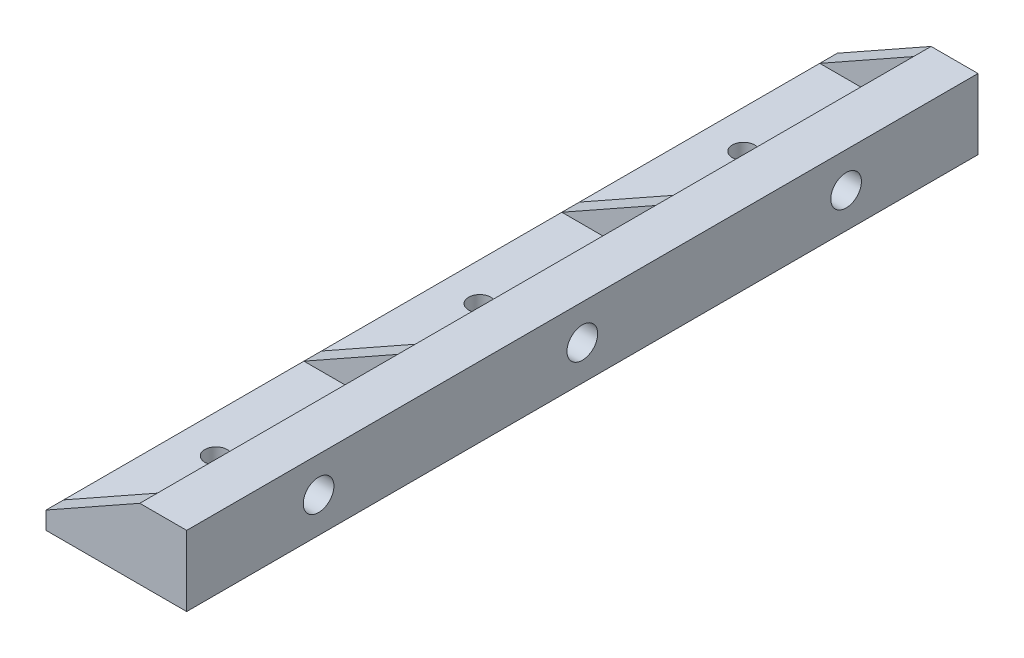
from build123d import *

# Parameters (mm, degrees)
BOSS_EXTRUDE1_DEPTH   = 135
RIB3_REACH            = 95.436
SKETCH4_WALL_W        = 207.229173432
SKETCH4_WALL_H        = 3
RIB4_START            = -3
RIB4_DEPTH            = 3
F_6_CLEARANCE_HOLE1_D = 3.7973
SKETCH6_R             = 2.3495
CUT_EXTRUDE1_DEPTH    = 7
SKETCH12_R            = 2.6162
CUT_EXTRUDE2_DEPTH    = 6.35


# Read off the part's stored shape, not the designer's step: Rib4
with BuildPart() as part:
    # Sketch1 → Boss-Extrude1 (new body)
    with BuildSketch(Plane.XY):
        with BuildLine():
            Line((0, 0), (0, 12))
            Line((0, 12), (-8, 12))
            Line((-8, 12), (-8, 6))
            ThreePointArc((-8, 6), (-8.878679656, 3.878679656), (-11, 3))
            Line((-11, 3), (-24, 3))
            Line((-24, 3), (-24, 0))
            Line((-24, 0), (0, 0))
        make_face()
    extrude(amount=BOSS_EXTRUDE1_DEPTH)

    # Sketch4 wall → Rib3 (add, up to next)
    with BuildSketch(Plane(origin=(-16, 7.5, 45.5), x_dir=(-0.871575537125, -0.490261239633, 0), z_dir=(-0.490261239633, 0.871575537125, 0)), mode=Mode.PRIVATE) as rib3_sk1:
        Rectangle(SKETCH4_WALL_W, SKETCH4_WALL_H)
    rib3_tool1 = extrude(rib3_sk1.sketch, amount=-RIB3_REACH, mode=Mode.PRIVATE) - part.part
    rib3 = rib3_tool1.solids().sort_by_distance((-16, 7.5, 45.5))[0]
    add(rib3)

    # Rib4 outline → Rib4 (add)
    with BuildSketch(Plane(origin=(0, 0, 0), x_dir=(-1, 0, 0), z_dir=(0, 0, -1)).offset(RIB4_START)):
        with BuildLine():
            Line((24, 3), (8, 12))
            Line((8, 12), (8, 6))
            ThreePointArc((8, 6), (8.878679656, 3.878679656), (11, 3))
            Line((11, 3), (24, 3))
        make_face()
    rib4 = extrude(amount=RIB4_DEPTH)

    # Mirror1: Rib3, Rib4 across plane
    add(rib3.mirror(Plane(origin=(0, 0, 67.5), x_dir=(1, 0, 0), z_dir=(0, 0, -1))))
    add(rib4.mirror(Plane(origin=(0, 0, 67.5), x_dir=(1, 0, 0), z_dir=(0, 0, -1))))

    # #6 Clearance Hole1 (through all)
    with Locations(Plane(origin=(0, 0, 0), x_dir=(-1, 0, 0), z_dir=(0, -1, 0))):
        with Locations((17.5, -22.5), (17.5, -112.5), (17.5, -67.5)):
            Hole(F_6_CLEARANCE_HOLE1_D / 2)

    # Sketch6 → Cut-Extrude1 (cut)
    with BuildSketch(Plane(origin=(0, 0, 0), x_dir=(0, 0, -1), z_dir=(1, 0, 0))):
        with Locations((-112.5, 6)):
            Circle(SKETCH6_R)
        with Locations((-67.5, 6)):
            Circle(SKETCH6_R)
        with Locations((-22.5, 6)):
            Circle(SKETCH6_R)
    extrude(amount=-CUT_EXTRUDE1_DEPTH, mode=Mode.SUBTRACT)

    # Sketch12 → Cut-Extrude2 (cut)
    with BuildSketch(Plane(origin=(0, 0, 0), x_dir=(0, 0, -1), z_dir=(1, 0, 0))):
        with Locations((-112.5, 6)):
            Circle(SKETCH12_R)
        with Locations((-67.5, 6)):
            Circle(SKETCH12_R)
        with Locations((-22.5, 6)):
            Circle(SKETCH12_R)
    extrude(amount=-CUT_EXTRUDE2_DEPTH, mode=Mode.SUBTRACT)


solid = part.part
